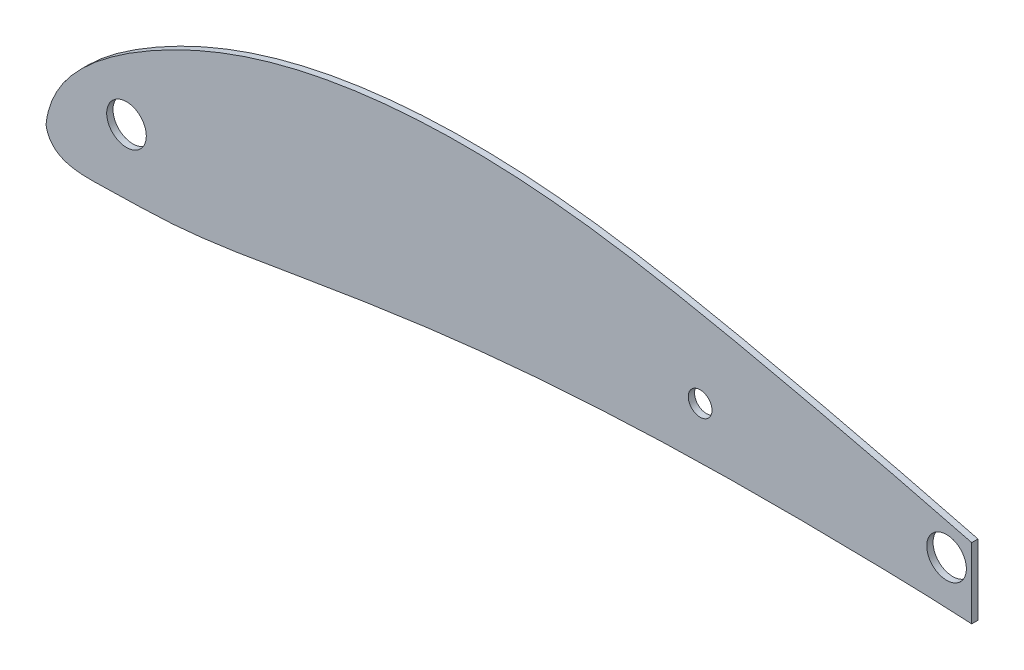
from build123d import *

# Parameters (mm, degrees)
BOSS_EXTRUDE1_DEPTH = 1.5875
SKETCH2_R           = 5
CUT_EXTRUDE1_DEPTH  = 316.731983488
SKETCH3_W           = 116.84
SKETCH3_H           = 50.8
CUT_EXTRUDE2_DEPTH  = 316.731983488
SKETCH4_R           = 3
CUT_EXTRUDE3_DEPTH  = 2.54


with BuildPart() as part:
    # Sketch1 → Boss-Extrude1 (new body)
    with BuildSketch(Plane.XY):
        with BuildLine():
            add(Edge.make_bspline(
                [(0.000560351, 0.000130087), (0.810633127, 7.359196055), (8.649092025, 17.856605174), (26.286719818, 29.975176328), (52.111128271, 42.069215275), (89.597618475, 49.290763054), (131.400792109, 47.884831915), (173.256699242, 40.041104278), (217.961060472, 29.612974894), (256.952064401, 19.528920948), (290.35983767, 8.71099439), (301.273197721, 4.382828139), (314.816918223, -0.516206742), (309.846313895, 0.000130087)],
                knots=[0, 0, 0, 0, 0.060863618, 0.113688265, 0.188608742, 0.312908923, 0.448482434, 0.557612135, 0.691544113, 0.852438279, 0.92975597, 0.976058229, 1, 1, 1, 1], degree=3))
            add(Edge.make_bspline(
                [(309.846313895, 0.000130087), (303.956832565, 1.47095521), (293.989507544, 2.093987313), (276.26402299, 4.514356704), (260.846344817, 5.427413394), (235.858814759, 7.870306192), (205.101424636, 8.838080282), (157.718638092, 9.030650149), (110.497331172, 6.181495223), (66.506197185, -0.586669107), (36.454672816, -6.098499901), (15.316603331, -6.189065841), (1.230714189, -6.924076091), (0.000560351, 0.000130087)],
                knots=[0, 0, 0, 0, 0.057787081, 0.095274891, 0.171021118, 0.205339302, 0.335319146, 0.464904334, 0.658702312, 0.785511947, 0.893517288, 0.94309214, 1, 1, 1, 1], degree=3))
        make_face()
    extrude(amount=BOSS_EXTRUDE1_DEPTH)

    # Sketch2 → Cut-Extrude1 (cut, through all)
    with BuildSketch(Plane.XY.offset(1.5875)):
        with Locations((20.32, 10.16)):
            Circle(SKETCH2_R)
        with Locations((227.296313895, 19.050130087)):
            Circle(SKETCH2_R)
    extrude(amount=-CUT_EXTRUDE1_DEPTH, mode=Mode.SUBTRACT)

    # Sketch3 → Cut-Extrude2 (cut, through all)
    with BuildSketch(Plane.XY.offset(1.5875)):
        with Locations((292.066313895, 19.050130087)):
            Rectangle(SKETCH3_W, SKETCH3_H)
    extrude(amount=-CUT_EXTRUDE2_DEPTH, mode=Mode.SUBTRACT)

    # Sketch4 → Cut-Extrude3 (cut)
    with BuildSketch(Plane(origin=(0, 0, 0), x_dir=(-1, 0, 0), z_dir=(0, 0, -1))):
        with Locations((-165.100560351, 21.590130087)):
            Circle(SKETCH4_R)
    extrude(amount=-CUT_EXTRUDE3_DEPTH, mode=Mode.SUBTRACT)


solid = part.part
